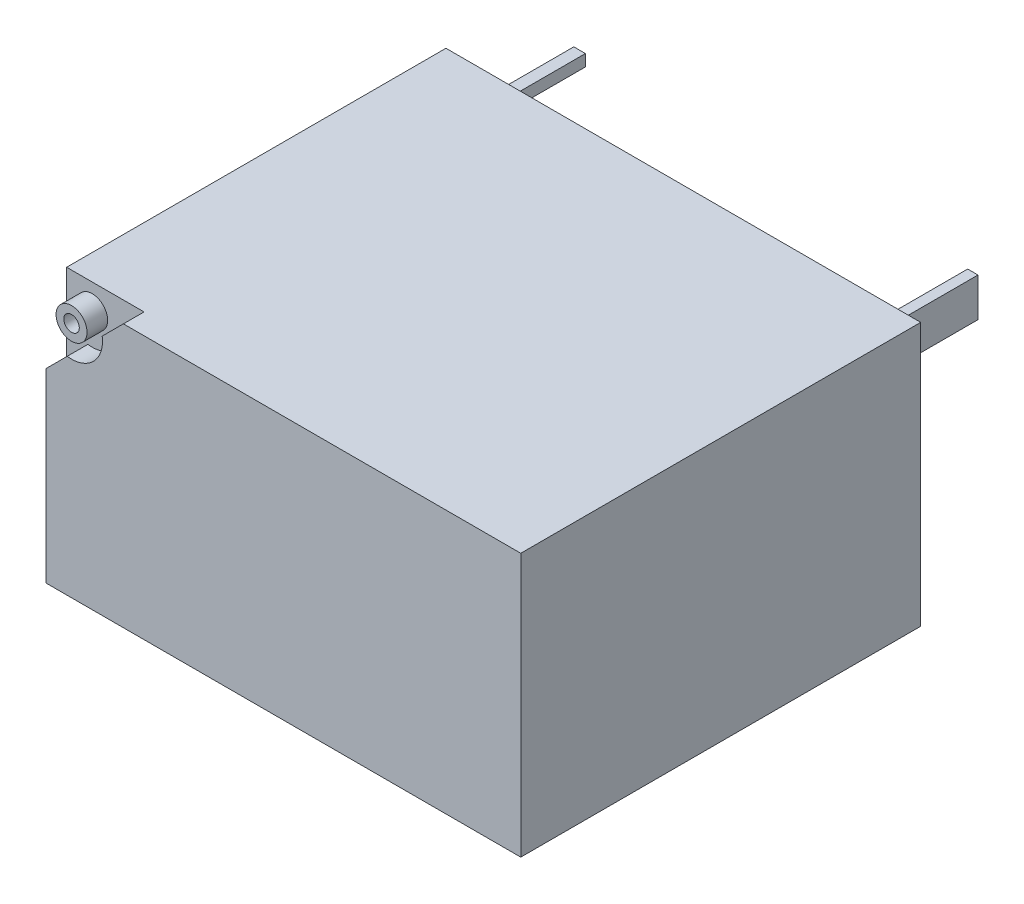
from build123d import *

# Parameters (mm, degrees)
SKETCH1_W                = 18.4
SKETCH1_H                = 10.2
BOSS_EXTRUDE1_DEPTH      = 15.5
BOSS_EXTRUDE2_DEPTH      = 3.6
BOSS_EXTRUDE3_DEPTH      = 3.6
CUT_EXTRUDE1_START       = -0.1
CUT_EXTRUDE1_OUTLINE_W   = 0.314162379
CUT_EXTRUDE1_OUTLINE_H   = 2.240690104
CUT_EXTRUDE1_OUTLINE_W_2 = 1.035639934
CUT_EXTRUDE1_OUTLINE_H_2 = 0.299093544
CUT_EXTRUDE1_DEPTH       = 0.1
SKETCH5_W                = 1.125139681
SKETCH5_H                = 0.299093543
CUT_EXTRUDE2_DEPTH       = 0.1
CUT_EXTRUDE4_DEPTH       = 0.8
SKETCH7_R                = 0.3
CUT_EXTRUDE5_DEPTH       = 10
BODY_MOVE_COPY1_ANGLE    = 180


# Read off the part's stored shape, not the designer's step: Cut-Extrude1
with BuildPart() as part:
    # Sketch1 → Boss-Extrude1 (new body)
    with BuildSketch(Plane.XY):
        Rectangle(SKETCH1_W, SKETCH1_H)
    extrude(amount=BOSS_EXTRUDE1_DEPTH)

    # Sketch2 → Boss-Extrude2 (add)
    with BuildSketch(Plane(origin=(0, 0, 0), x_dir=(-1, 0, 0), z_dir=(0, 0, -1))):
        Polygon((-7.62, 4.025), (-7.395, 4.025), (-7.395, 3.575), (-7.845, 3.575), (-7.845, 3.8), (-7.845, 4.025), align=None)
        Polygon((-7.395, -3.8), (-7.395, -3.575), (-7.845, -3.575), (-7.845, -4.025), (-7.395, -4.025), align=None)
    extrude(amount=BOSS_EXTRUDE2_DEPTH)

    # Sketch3 → Boss-Extrude3 (add)
    with BuildSketch(Plane(origin=(0, 0, 0), x_dir=(-1, 0, 0), z_dir=(0, 0, -1))):
        Polygon((5.23, 3.45), (5.23, 2.7), (4.93, 2.7), (4.93, 4.2), (5.23, 4.2), align=None)
        Polygon((7.62, -2.7), (7.82, -2.7), (7.82, -4.2), (7.42, -4.2), (7.42, -2.7), align=None)
    extrude(amount=BOSS_EXTRUDE3_DEPTH)

    # Cut-Extrude1 outline → Cut-Extrude1 (cut)
    # profile 1 of 10: a face of its own
    with BuildSketch(Plane(origin=(0, 5.1, 0), x_dir=(1, 0, 0), z_dir=(0, 1, 0)).offset(CUT_EXTRUDE1_START)):
        with BuildLine():
            add(Edge.make_bspline(
                [(-7.308841616, -12.286202215), (-7.30803105, -12.251449242), (-7.30646354, -12.184242276), (-7.292577768, -12.087326915), (-7.270031638, -11.998027243), (-7.237969478, -11.916680055), (-7.197543518, -11.843428863), (-7.147580255, -11.779480636), (-7.088908435, -11.725060617), (-7.022055477, -11.679976699), (-6.947388712, -11.644609407), (-6.86538238, -11.619721685), (-6.776527866, -11.604347148), (-6.714981152, -11.602608166), (-6.683256647, -11.6017118)],
                knots=[0, 0, 0, 0, 0.098898763, 0.191255172, 0.278072365, 0.360555824, 0.439518311, 0.515457239, 0.590581914, 0.666423098, 0.744152347, 0.824886956, 0.909737264, 1, 1, 1, 1], degree=3))
            Line((-7.308841616, -12.286202215), (-7.308841616, -12.287572109))
            add(Edge.make_bspline(
                [(-6.755861033, -12.956537058), (-6.783932565, -12.955597775), (-6.838348199, -12.953777008), (-6.916978194, -12.93897417), (-6.989381574, -12.914139977), (-7.055770721, -12.87997324), (-7.114697873, -12.835493447), (-7.166538621, -12.782296782), (-7.210715078, -12.719908487), (-7.246595398, -12.648504933), (-7.274905776, -12.569055129), (-7.294668246, -12.481835225), (-7.306589726, -12.387143403), (-7.308073141, -12.321551565), (-7.308841616, -12.287572109)],
                knots=[0, 0, 0, 0, 0.085516542, 0.16577068, 0.24279655, 0.318121449, 0.39235113, 0.466825424, 0.54367785, 0.624389296, 0.709648728, 0.800129237, 0.896458158, 1, 1, 1, 1], degree=3))
            add(Edge.make_bspline(
                [(-6.541189772, -12.889217444), (-6.543609597, -12.891152471), (-6.556899269, -12.901403099), (-6.583135265, -12.917781768), (-6.621645264, -12.935293373), (-6.663663277, -12.947360568), (-6.708659157, -12.955590183), (-6.739839759, -12.956215669), (-6.755861033, -12.956537058)],
                knots=[0.327088452, 0.327088452, 0.327088452, 0.327088452, 0.354371989, 0.474879064, 0.598478454, 0.725731814, 0.859075013, 1, 1, 1, 1], degree=3))
            Line((-6.541189772, -12.889217444), (-7.040799005, -13.865690104))
            Line((-7.040799005, -13.865690104), (-6.701521901, -13.865690104))
            Line((-6.701521901, -13.865690104), (-6.214752867, -12.901284663))
            add(Edge.make_bspline(
                [(-6.173199413, -12.811784916), (-6.176309152, -12.819434098), (-6.18252281, -12.834718143), (-6.193397223, -12.856942706), (-6.203599436, -12.879381396), (-6.211045737, -12.894004548), (-6.214752867, -12.901284663)],
                knots=[0, 0, 0, 0, 0.250888691, 0.501307753, 0.751726814, 1, 1, 1, 1], degree=3))
            add(Edge.make_bspline(
                [(-6.059041572, -12.279809376), (-6.059402298, -12.300977991), (-6.060132696, -12.343840197), (-6.06588092, -12.408772234), (-6.07504779, -12.475215453), (-6.092195848, -12.565712393), (-6.12137182, -12.679676504), (-6.155827137, -12.767503025), (-6.173199413, -12.811784916)],
                knots=[0, 0, 0, 0, 0.115988873, 0.234854247, 0.356944838, 0.483402176, 0.739532801, 1, 1, 1, 1], degree=3))
            Line((-6.059041572, -12.279809376), (-6.059041572, -12.278439482))
            add(Edge.make_bspline(
                [(-6.683256647, -11.6017118), (-6.651543666, -11.602669981), (-6.590044594, -11.604528123), (-6.501201304, -11.619025671), (-6.419685229, -11.644287798), (-6.34538176, -11.679026569), (-6.278945087, -11.723665938), (-6.220914092, -11.777753191), (-6.170783429, -11.840615727), (-6.130338567, -11.912998446), (-6.098525234, -11.993385449), (-6.075071485, -12.081431788), (-6.061477257, -12.177404178), (-6.059871916, -12.243995754), (-6.059041572, -12.278439482)],
                knots=[0, 0, 0, 0, 0.090934704, 0.17634419, 0.257262819, 0.334989287, 0.41078899, 0.485855944, 0.561674503, 0.640464074, 0.722750254, 0.809057696, 0.901237284, 1, 1, 1, 1], degree=3))
        make_face()
        with BuildLine():
            add(Edge.make_bspline(
                [(-6.373660582, -12.258347702), (-6.373952041, -12.244490056), (-6.374516798, -12.21763831), (-6.378058461, -12.178532432), (-6.384578444, -12.141946576), (-6.392981786, -12.107606358), (-6.404519399, -12.075798427), (-6.41861096, -12.046569543), (-6.435261072, -12.019881208), (-6.453878873, -11.995359615), (-6.475521562, -11.974082769), (-6.498741488, -11.955114005), (-6.524496338, -11.939416364), (-6.552114983, -11.926198693), (-6.582014324, -11.916067669), (-6.613942882, -11.909523162), (-6.647790657, -11.904558792), (-6.671211993, -11.904190937), (-6.683256647, -11.904001764)],
                knots=[0, 0, 0, 0, 0.077696827, 0.150551932, 0.219857215, 0.285880081, 0.348506732, 0.409190493, 0.467443584, 0.524624247, 0.581344593, 0.6371851, 0.692363118, 0.750000422, 0.808558978, 0.868815235, 0.932536942, 1, 1, 1, 1], degree=3))
            Line((-6.373660582, -12.258347702), (-6.373660582, -12.260174228))
            add(Edge.make_bspline(
                [(-6.66773118, -12.654703726), (-6.656302559, -12.654290876), (-6.634114221, -12.65348934), (-6.601729441, -12.649055734), (-6.571519542, -12.64083423), (-6.543476038, -12.629169319), (-6.516969945, -12.615096476), (-6.49278311, -12.596987618), (-6.470235099, -12.576002708), (-6.450124439, -12.551411689), (-6.431936808, -12.524261595), (-6.416340807, -12.494182967), (-6.403138836, -12.461603811), (-6.392079814, -12.426368445), (-6.384116116, -12.388406453), (-6.378166261, -12.347998697), (-6.374492078, -12.304990908), (-6.373943118, -12.275402593), (-6.373660582, -12.260174228)],
                knots=[0, 0, 0, 0, 0.0616631, 0.119717121, 0.175882699, 0.230006983, 0.283277677, 0.337302239, 0.392481051, 0.449035323, 0.50823904, 0.568464316, 0.631430854, 0.697648076, 0.767375765, 0.840408554, 0.917862279, 1, 1, 1, 1], degree=3))
            add(Edge.make_bspline(
                [(-6.994679237, -12.261544122), (-6.994452537, -12.276778529), (-6.99401186, -12.306392297), (-6.989553039, -12.349503606), (-6.983745526, -12.390116026), (-6.973696219, -12.427821383), (-6.962172145, -12.46314092), (-6.947356209, -12.49558262), (-6.930588935, -12.525739239), (-6.91043177, -12.552582935), (-6.887801594, -12.576484616), (-6.863294767, -12.59776525), (-6.835826207, -12.615042699), (-6.806775831, -12.629887738), (-6.775035804, -12.640727084), (-6.741471135, -12.649094761), (-6.705288172, -12.653489839), (-6.680526941, -12.654290152), (-6.66773118, -12.654703726)],
                knots=[0, 0, 0, 0, 0.07865921, 0.152903596, 0.223739266, 0.290291454, 0.354189951, 0.41542071, 0.474225874, 0.532093232, 0.5882694, 0.64404247, 0.699219377, 0.755478015, 0.812174471, 0.872052601, 0.933881139, 1, 1, 1, 1], degree=3))
            Line((-6.994679237, -12.261544122), (-6.994679237, -12.260174228))
            add(Edge.make_bspline(
                [(-6.683256647, -11.904001764), (-6.695297609, -11.904212069), (-6.718862723, -11.904623654), (-6.753089484, -11.909370229), (-6.78535399, -11.916640075), (-6.815523964, -11.926648668), (-6.843720809, -11.939378455), (-6.869364802, -11.955542573), (-6.892999518, -11.974503959), (-6.914286086, -11.996290077), (-6.933251549, -12.020830022), (-6.949583999, -12.047879574), (-6.963845066, -12.077152318), (-6.975351538, -12.108980803), (-6.983760864, -12.143315356), (-6.990317731, -12.180051165), (-6.993801122, -12.219314862), (-6.994381432, -12.246317112), (-6.994679237, -12.260174228)],
                knots=[0, 0, 0, 0, 0.067082677, 0.131286091, 0.192215482, 0.251248237, 0.308201391, 0.364236913, 0.41976257, 0.47676627, 0.533624528, 0.592271824, 0.652613429, 0.714886968, 0.780537574, 0.849452088, 0.922741256, 1, 1, 1, 1], degree=3))
        make_face(mode=Mode.SUBTRACT)
    # profile 2 of 10: a face of its own
    with BuildSketch(Plane(origin=(0, 5.1, 0), x_dir=(1, 0, 0), z_dir=(0, 1, 0)).offset(CUT_EXTRUDE1_START)):
        with BuildLine():
            add(Edge.make_bspline(
                [(0.950249869, -12.939641698), (0.939380286, -12.954565205), (0.917886403, -12.984075456), (0.889779647, -13.030316414), (0.864751457, -13.07713635), (0.843977276, -13.124603), (0.827396713, -13.171740775), (0.816220038, -13.217679298), (0.808110538, -13.261738754), (0.807275805, -13.2907569), (0.806867621, -13.304946789)],
                knots=[0, 0, 0, 0, 0.138823185, 0.274513684, 0.406655624, 0.53790667, 0.6639142, 0.7819335, 0.893365368, 1, 1, 1, 1], degree=3))
            Line((0.950249869, -12.939641698), (1.731546133, -11.897608924))
            Line((1.731546133, -11.897608924), (1.731546133, -11.625))
            Line((1.731546133, -11.625), (0.467590517, -11.625))
            Line((0.467590517, -11.625), (0.467590517, -11.924093544))
            Line((0.467590517, -11.924093544), (1.31555496, -11.924093544))
            Line((1.31555496, -11.924093544), (0.666681792, -12.805392076))
            add(Edge.make_bspline(
                [(0.479919564, -13.303120263), (0.480594865, -13.283149723), (0.48196759, -13.242554447), (0.49146381, -13.181058187), (0.507207242, -13.118351154), (0.528773624, -13.05461078), (0.555485306, -12.99060114), (0.587743491, -12.927392201), (0.624568471, -12.865234214), (0.652560537, -12.825458081), (0.666681792, -12.805392076)],
                knots=[0, 0, 0, 0, 0.110936834, 0.225507744, 0.344874804, 0.469757772, 0.599010686, 0.729863687, 0.863723394, 1, 1, 1, 1], degree=3))
            Line((0.479919564, -13.303120263), (0.479919564, -13.304946789))
            add(Edge.make_bspline(
                [(1.111897372, -13.888978304), (1.079725014, -13.888343686), (1.017369527, -13.88711369), (0.92777493, -13.873300795), (0.844907498, -13.852835477), (0.769765203, -13.822679737), (0.702618555, -13.784203489), (0.64353258, -13.738040085), (0.593271749, -13.683601458), (0.551979925, -13.621214287), (0.519196648, -13.551767209), (0.496914444, -13.475141445), (0.48211601, -13.392275541), (0.480667816, -13.334696618), (0.479919564, -13.304946789)],
                knots=[0, 0, 0, 0, 0.098594261, 0.191092405, 0.277373238, 0.359903528, 0.438539172, 0.514002484, 0.588996463, 0.66474228, 0.742639989, 0.823575676, 0.908845231, 1, 1, 1, 1], degree=3))
            add(Edge.make_bspline(
                [(1.759400646, -13.280288695), (1.754283862, -13.311333904), (1.744314053, -13.371824008), (1.718597066, -13.45792568), (1.687033283, -13.537503486), (1.647577181, -13.609448866), (1.601742549, -13.673970153), (1.549425225, -13.730659514), (1.490439161, -13.779110802), (1.425123079, -13.818828382), (1.354384584, -13.850751982), (1.277992117, -13.872937065), (1.19654701, -13.886410072), (1.140565968, -13.888108512), (1.111897372, -13.888978304)],
                knots=[0, 0, 0, 0, 0.096088068, 0.187223009, 0.274052084, 0.357338622, 0.437384786, 0.515411073, 0.592437768, 0.66991839, 0.748431429, 0.828958858, 0.912407679, 1, 1, 1, 1], degree=3))
            Line((1.759400646, -13.280288695), (1.759400646, -13.27846217))
            Line((1.759400646, -13.27846217), (1.434279115, -13.27846217))
            Line((1.434279115, -13.27846217), (1.434279115, -13.280288695))
            add(Edge.make_bspline(
                [(1.108700952, -13.58988476), (1.130554002, -13.588987763), (1.17269552, -13.587257989), (1.232774051, -13.57207952), (1.285847047, -13.545894329), (1.332379675, -13.510274055), (1.3709294, -13.464833105), (1.401397265, -13.410948756), (1.422976078, -13.348521633), (1.430395956, -13.303730122), (1.434279115, -13.280288695)],
                knots=[0, 0, 0, 0, 0.131549983, 0.253681575, 0.370179384, 0.485941887, 0.604330831, 0.726744522, 0.856993032, 1, 1, 1, 1], degree=3))
            add(Edge.make_bspline(
                [(0.806867621, -13.308143208), (0.807770583, -13.32923981), (0.809496211, -13.369556964), (0.824249371, -13.426548583), (0.849168919, -13.476109558), (0.88424976, -13.517620376), (0.928356851, -13.550650033), (0.981605942, -13.573344582), (1.042490729, -13.587767265), (1.085932385, -13.58915659), (1.108700952, -13.58988476)],
                knots=[0, 0, 0, 0, 0.134797039, 0.257607039, 0.373440718, 0.486767218, 0.602248408, 0.722566583, 0.854592064, 1, 1, 1, 1], degree=3))
            Line((0.806867621, -13.308143208), (0.806867621, -13.304946789))
        make_face()
    # profile 3 of 10: a face of its own
    with BuildSketch(Plane(origin=(0, 5.1, 0), x_dir=(1, 0, 0), z_dir=(0, 1, 0)).offset(CUT_EXTRUDE1_START)):
        with BuildLine():
            add(Edge.make_bspline(
                [(2.141144467, -12.219990668), (2.141922525, -12.188426865), (2.143427048, -12.127392237), (2.157765571, -12.039470785), (2.181431211, -11.958851321), (2.214454176, -11.885416647), (2.256655755, -11.819609399), (2.307757048, -11.761729871), (2.368162297, -11.713061969), (2.436254159, -11.672085761), (2.512635305, -11.639945557), (2.596807807, -11.618215002), (2.688014169, -11.604012623), (2.751298837, -11.602496947), (2.784081428, -11.6017118)],
                knots=[0, 0, 0, 0, 0.09332737, 0.180466259, 0.262679855, 0.341281763, 0.417855365, 0.49313757, 0.568675256, 0.646447159, 0.727576882, 0.812890671, 0.903074017, 1, 1, 1, 1], degree=3))
            Line((2.141144467, -12.219990668), (2.141144467, -12.256977808))
            add(Edge.make_bspline(
                [(2.526541338, -12.794889555), (2.511534223, -12.791396867), (2.482024352, -12.784528873), (2.440050921, -12.769052375), (2.400391891, -12.75128368), (2.363299246, -12.73031066), (2.329036673, -12.70596139), (2.297044251, -12.678802173), (2.268014139, -12.648191329), (2.241437498, -12.614723468), (2.217566528, -12.578605603), (2.197099272, -12.539690051), (2.179699861, -12.498438986), (2.165483733, -12.454760094), (2.154571833, -12.408622313), (2.147071574, -12.360056485), (2.141630566, -12.309308412), (2.14130862, -12.27464953), (2.141144467, -12.256977808)],
                knots=[0, 0, 0, 0, 0.063926765, 0.125705076, 0.185391495, 0.244269208, 0.30231663, 0.359699524, 0.418264273, 0.477196246, 0.536976301, 0.597766982, 0.659516184, 0.722679064, 0.788295869, 0.856151611, 0.926655202, 1, 1, 1, 1], degree=3))
            add(Edge.make_bspline(
                [(2.178131607, -13.269329543), (2.179030871, -13.242128107), (2.180788519, -13.188961801), (2.199102428, -13.112171879), (2.227197477, -13.040523778), (2.267491358, -12.975228762), (2.317987695, -12.916833642), (2.378553396, -12.866771035), (2.448457317, -12.824881868), (2.500006964, -12.80508149), (2.526541338, -12.794889555)],
                knots=[0, 0, 0, 0, 0.129011766, 0.252158711, 0.372880409, 0.493307188, 0.6148061, 0.738042188, 0.865161318, 1, 1, 1, 1], degree=3))
            Line((2.178131607, -13.269329543), (2.178131607, -13.306316683))
            add(Edge.make_bspline(
                [(2.785451322, -13.888978304), (2.761987668, -13.88861444), (2.716309227, -13.887906079), (2.649931752, -13.88027021), (2.587465862, -13.86882801), (2.529306522, -13.851466977), (2.474497691, -13.831110762), (2.424502038, -13.803974752), (2.378127711, -13.773181793), (2.336327626, -13.737110397), (2.298841183, -13.697194111), (2.266645008, -13.652692338), (2.239030535, -13.604559922), (2.21675476, -13.552244202), (2.199326714, -13.496241265), (2.187271706, -13.43640533), (2.17908216, -13.372754546), (2.178454304, -13.328871268), (2.178131607, -13.306316683)],
                knots=[0, 0, 0, 0, 0.073506527, 0.143100626, 0.209156297, 0.27226229, 0.333126723, 0.392030089, 0.450116394, 0.507294428, 0.564677084, 0.621357395, 0.679050557, 0.738246842, 0.799206552, 0.862548329, 0.929354287, 1, 1, 1, 1], degree=3))
            add(Edge.make_bspline(
                [(3.418799024, -13.308143208), (3.413123688, -13.337651819), (3.402053509, -13.395210629), (3.376334497, -13.477482096), (3.343281678, -13.553108662), (3.304179074, -13.622427453), (3.258512347, -13.684282225), (3.20674418, -13.738379122), (3.149512111, -13.784834132), (3.086342134, -13.823008682), (3.01800847, -13.852818275), (2.944588282, -13.873678183), (2.866600165, -13.886887689), (2.812903802, -13.888271053), (2.785451322, -13.888978304)],
                knots=[0, 0, 0, 0, 0.0953122, 0.185913763, 0.272877683, 0.356821399, 0.437977891, 0.516218148, 0.593849092, 0.671227126, 0.749754669, 0.829711909, 0.912939534, 1, 1, 1, 1], degree=3))
            Line((3.418799024, -13.308143208), (3.100070332, -13.308143208))
            add(Edge.make_bspline(
                [(2.785451322, -13.586688341), (2.798557384, -13.586341771), (2.824128781, -13.585665574), (2.861435433, -13.580270715), (2.896210667, -13.570417636), (2.929102481, -13.557829204), (2.959670738, -13.540585226), (2.987859634, -13.519303652), (3.01326385, -13.4934777), (3.036716038, -13.464306511), (3.057099191, -13.430721305), (3.075084826, -13.393506266), (3.089687552, -13.35228944), (3.096544104, -13.323136272), (3.100070332, -13.308143208)],
                knots=[0, 0, 0, 0, 0.0853638, 0.166554339, 0.244734484, 0.320409757, 0.395432646, 0.472574731, 0.549697696, 0.630839785, 0.715868937, 0.805007465, 0.899718084, 1, 1, 1, 1], degree=3))
            add(Edge.make_bspline(
                [(2.492750617, -13.309513103), (2.493426242, -13.330471834), (2.494712711, -13.370379687), (2.50987124, -13.426364644), (2.533732247, -13.475228613), (2.567653297, -13.51611462), (2.610692682, -13.548314164), (2.662184779, -13.570491354), (2.721242232, -13.58451317), (2.76329371, -13.585937721), (2.785451322, -13.586688341)],
                knots=[0, 0, 0, 0, 0.13689488, 0.260663706, 0.376541738, 0.490488082, 0.605094939, 0.725103365, 0.85515246, 1, 1, 1, 1], degree=3))
            Line((2.492750617, -13.309513103), (2.492750617, -13.240105135))
            add(Edge.make_bspline(
                [(2.768555961, -12.939641698), (2.747922253, -12.94056536), (2.708369242, -12.942335941), (2.652461297, -12.956880991), (2.60409874, -12.982265785), (2.56309368, -13.016878769), (2.531265738, -13.061252451), (2.50875832, -13.113912293), (2.495009476, -13.1744166), (2.49352793, -13.217500552), (2.492750617, -13.240105135)],
                knots=[0, 0, 0, 0, 0.133583326, 0.256067524, 0.370764031, 0.484797154, 0.600595057, 0.721162352, 0.853704026, 1, 1, 1, 1], degree=3))
            Line((2.768555961, -12.939641698), (2.927463676, -12.939641698))
            Line((2.927463676, -12.939641698), (2.927463676, -12.640548154))
            Line((2.927463676, -12.640548154), (2.768555961, -12.640548154))
            add(Edge.make_bspline(
                [(2.455763477, -12.289398635), (2.456058997, -12.302952919), (2.456637842, -12.329502134), (2.460190269, -12.368136272), (2.466431143, -12.404391053), (2.475865097, -12.43802877), (2.486896388, -12.469593271), (2.501347627, -12.498494176), (2.517736489, -12.52530985), (2.536981909, -12.549438731), (2.558367287, -12.571173634), (2.582558471, -12.589277094), (2.608053547, -12.60568485), (2.636307426, -12.618305625), (2.666390376, -12.628513746), (2.698793705, -12.635015618), (2.73293968, -12.639971639), (2.756511548, -12.640353193), (2.768555961, -12.640548154)],
                knots=[0, 0, 0, 0, 0.076049913, 0.148961424, 0.217479299, 0.282119327, 0.344794465, 0.404757774, 0.463055966, 0.520807394, 0.577571654, 0.633598769, 0.689995661, 0.747316102, 0.806729557, 0.867867252, 0.93248471, 1, 1, 1, 1], degree=3))
            Line((2.455763477, -12.289398635), (2.455763477, -12.221360562))
            add(Edge.make_bspline(
                [(2.784081428, -11.904001764), (2.771444741, -11.904313571), (2.746878107, -11.904919748), (2.711025818, -11.908205665), (2.67763356, -11.915603661), (2.645832448, -11.923673822), (2.616660994, -11.935905717), (2.589372654, -11.949913936), (2.564541407, -11.967129123), (2.541685684, -11.986541781), (2.521706824, -12.008773116), (2.503466325, -12.0323833), (2.489058845, -12.058941674), (2.476384953, -12.087175136), (2.467664363, -12.11802476), (2.460606185, -12.150622309), (2.456524695, -12.185336285), (2.456020996, -12.209173589), (2.455763477, -12.221360562)],
                knots=[0, 0, 0, 0, 0.073054831, 0.142023885, 0.207576539, 0.270528191, 0.331290961, 0.389915119, 0.447493938, 0.505501157, 0.56277684, 0.619951119, 0.677449258, 0.736931584, 0.798434735, 0.862265165, 0.929582196, 1, 1, 1, 1], degree=3))
            add(Edge.make_bspline(
                [(3.135230947, -12.183003527), (3.132742429, -12.167688567), (3.127918921, -12.138003499), (3.114318069, -12.096456347), (3.097643722, -12.058667846), (3.075834281, -12.025821783), (3.050952065, -11.99654307), (3.022506052, -11.971351419), (2.990708925, -11.950132976), (2.955576405, -11.933251618), (2.91728306, -11.91993615), (2.875798845, -11.91045513), (2.830957839, -11.904967473), (2.800079235, -11.904331337), (2.784081428, -11.904001764)],
                knots=[0, 0, 0, 0, 0.093404106, 0.181045679, 0.262760667, 0.341660391, 0.417801133, 0.493853352, 0.569949845, 0.647514925, 0.728192879, 0.813891369, 0.90357951, 1, 1, 1, 1], degree=3))
            Line((3.135230947, -12.183003527), (3.455786164, -12.183003527))
            add(Edge.make_bspline(
                [(2.784081428, -11.6017118), (2.814426358, -11.602376442), (2.873748306, -11.603675764), (2.959748092, -11.617427851), (3.04048735, -11.638585908), (3.115067253, -11.668926142), (3.183854149, -11.70674639), (3.245295189, -11.753393734), (3.30031628, -11.807112088), (3.34748019, -11.868947239), (3.387336865, -11.937635694), (3.41892336, -12.013314469), (3.442417118, -12.095665282), (3.451246585, -12.153347046), (3.455786164, -12.183003527)],
                knots=[0, 0, 0, 0, 0.092431528, 0.180696349, 0.264774907, 0.346372662, 0.425512512, 0.503372897, 0.580807657, 0.659230118, 0.739690641, 0.822248465, 0.908610891, 1, 1, 1, 1], degree=3))
        make_face()
    # profile 4 of 10: a face of its own
    with BuildSketch(Plane(origin=(0, 5.1, 0), x_dir=(1, 0, 0), z_dir=(0, 1, 0)).offset(CUT_EXTRUDE1_START)):
        Polygon((5.93118479, -13.865690104), (5.93118479, -12.877996463), (5.764514342, -12.877996463), (5.764514342, -12.57890292), (5.93118479, -12.57890292), (5.93118479, -11.625), (5.61656578, -11.625), (5.61656578, -13.865690104), align=None)
    # profile 5 of 10: a face of its own
    with BuildSketch(Plane(origin=(0, 5.1, 0), x_dir=(1, 0, 0), z_dir=(0, 1, 0)).offset(CUT_EXTRUDE1_START)):
        Polygon((3.660357015, -13.865690104), (5.070434668, -13.865690104), (5.070434668, -11.625), (4.75627229, -11.625), (4.75627229, -12.568400398), (3.830223883, -12.568400398), (3.830223883, -12.867037311), (4.75627229, -12.867037311), (4.75627229, -13.567053192), (3.660357015, -13.567053192), align=None)
    # profile 6 of 10: a face of its own
    with BuildSketch(Plane(origin=(0, 5.1, 0), x_dir=(1, 0, 0), z_dir=(0, 1, 0)).offset(CUT_EXTRUDE1_START)):
        with Locations((7.046735212, -12.745345052)):
            Rectangle(CUT_EXTRUDE1_OUTLINE_W, CUT_EXTRUDE1_OUTLINE_H)
    # profile 7 of 10: a face of its own
    with BuildSketch(Plane(origin=(0, 5.1, 0), x_dir=(1, 0, 0), z_dir=(0, 1, 0)).offset(CUT_EXTRUDE1_START)):
        Polygon((-1.395465449, -13.865690104), (0.014612204, -13.865690104), (0.014612204, -11.625), (-0.299550175, -11.625), (-0.299550175, -12.568400398), (-1.225598582, -12.568400398), (-1.225598582, -12.867037311), (-0.299550175, -12.867037311), (-0.299550175, -13.567053192), (-1.395465449, -13.567053192), align=None)
    # profile 8 of 10: a face of its own
    with BuildSketch(Plane(origin=(0, 5.1, 0), x_dir=(1, 0, 0), z_dir=(0, 1, 0)).offset(CUT_EXTRUDE1_START)):
        Polygon((-1.849813656, -13.865690104), (-1.507340133, -13.865690104), (-2.237950316, -11.625), (-2.53704386, -11.625), (-3.267654042, -13.865690104), (-2.925180519, -13.865690104), (-2.387268772, -12.109029246), align=None)
    # profile 9 of 10: a face of its own
    with BuildSketch(Plane(origin=(0, 5.1, 0), x_dir=(1, 0, 0), z_dir=(0, 1, 0)).offset(CUT_EXTRUDE1_START)):
        Polygon((-5.594190843, -13.865690104), (-5.279571833, -13.865690104), (-4.960843141, -13.65335652), (-4.960843141, -13.327778357), (-5.279571833, -13.523673212), (-5.279571833, -11.625), (-5.594190843, -11.625), align=None)
    # profile 10 of 10: a face of its own
    with BuildSketch(Plane(origin=(0, 5.1, 0), x_dir=(1, 0, 0), z_dir=(0, 1, 0)).offset(CUT_EXTRUDE1_START)):
        with Locations((-4.06675893, -12.427986254)):
            Rectangle(CUT_EXTRUDE1_OUTLINE_W_2, CUT_EXTRUDE1_OUTLINE_H_2)
    extrude(amount=CUT_EXTRUDE1_DEPTH, mode=Mode.SUBTRACT)

    # Sketch5 → Cut-Extrude2 (cut)
    with BuildSketch(Plane(origin=(0, 5.1, 0), x_dir=(1, 0, 0), z_dir=(0, 1, 0))):
        with Locations((6.327084183, -12.728449691)):
            Rectangle(SKETCH5_W, SKETCH5_H)
    extrude(amount=-CUT_EXTRUDE2_DEPTH, mode=Mode.SUBTRACT)

    # Sketch6 → Cut-Extrude4 (cut)
    with BuildSketch(Plane.XY.offset(15.5)):
        with BuildLine():
            Line((6.2, -5.1), (9.2, -5.1))
            Line((9.2, -5.1), (9.2, -2.1))
            Line((9.2, -2.1), (8.378121288, -2.921878712))
            ThreePointArc((8.378121288, -2.921878712), (7.361522369, -3.261522369), (7.021878712, -4.278121288))
            Line((7.021878712, -4.278121288), (6.2, -5.1))
        make_face()
        with BuildLine():
            ThreePointArc((8.810050506, -4.110050506), (8.764378226, -4.339660566), (8.634314575, -4.534314575))
            ThreePointArc((8.634314575, -4.534314575), (7.655722787, -3.880440447), (8.810050506, -4.110050506))
        make_face(mode=Mode.SUBTRACT)
    extrude(amount=-CUT_EXTRUDE4_DEPTH, mode=Mode.SUBTRACT)

    # Sketch7 → Cut-Extrude5 (cut)
    with BuildSketch(Plane.XY.offset(15.5)):
        with Locations((8.210050506, -4.110050506)):
            Circle(SKETCH7_R)
    extrude(amount=-CUT_EXTRUDE5_DEPTH, mode=Mode.SUBTRACT)


with BuildPart() as part_1:
    # Body-Move/Copy1: moved
    add(part.part.rotate(Axis((0, 0, 0), (0, 0, 1)), BODY_MOVE_COPY1_ANGLE))


solid = part_1.part
